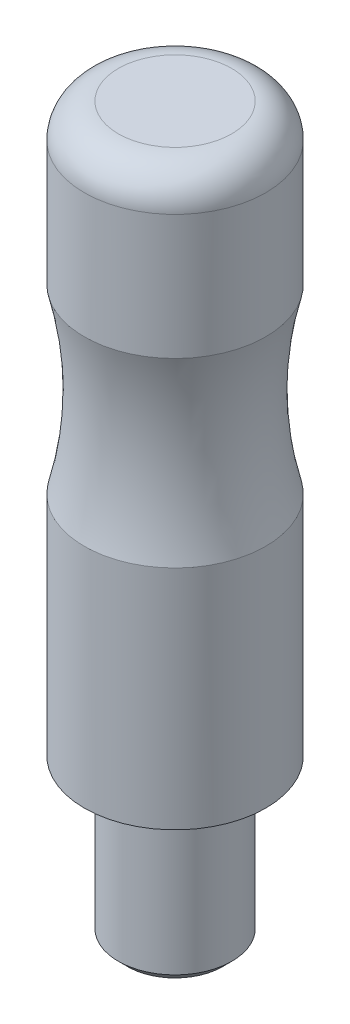
from build123d import *

# Parameters (mm, degrees)
SKETCH1_R           = 4
BOSS_EXTRUDE1_DEPTH = 25
SKETCH2_R           = 2.5
BOSS_EXTRUDE2_DEPTH = 7
CHAMFER1_SIZE       = 0.4
FILLET1_R           = 1.5


with BuildPart() as part:
    # Sketch1 → Boss-Extrude1 (new body)
    with BuildSketch(Plane(origin=(0, 0, 0), x_dir=(1, 0, 0), z_dir=(0, 1, 0))):
        Circle(SKETCH1_R)
    extrude(amount=BOSS_EXTRUDE1_DEPTH)

    # Sketch2 → Boss-Extrude2 (add)
    with BuildSketch(Plane.XZ):
        Circle(SKETCH2_R)
    extrude(amount=BOSS_EXTRUDE2_DEPTH)

    # Chamfer1
    chamfer1_edges = [part.edges().sort_by_distance(p)[0] for p in [
        (-2.5, -7, 0),
    ]]
    chamfer(chamfer1_edges, length=CHAMFER1_SIZE)

    # Fillet1
    fillet1_edges = [part.edges().sort_by_distance(p)[0] for p in [
        (-4, 25, 0),
    ]]
    fillet(fillet1_edges, radius=FILLET1_R)

    # Sketch3 → Cut-Revolve1 (revolve, cut)
    with BuildSketch(Plane.XY):
        with BuildLine():
            Line((-4, 18), (-5, 18))
            Line((-5, 18), (-5, 10))
            Line((-5, 10), (-4, 10))
            ThreePointArc((-4, 10), (-3.491933385, 14), (-4, 18))
        make_face()
    revolve(axis=Axis((0, 0, 0), (0, 1, 0)), mode=Mode.SUBTRACT)


solid = part.part
